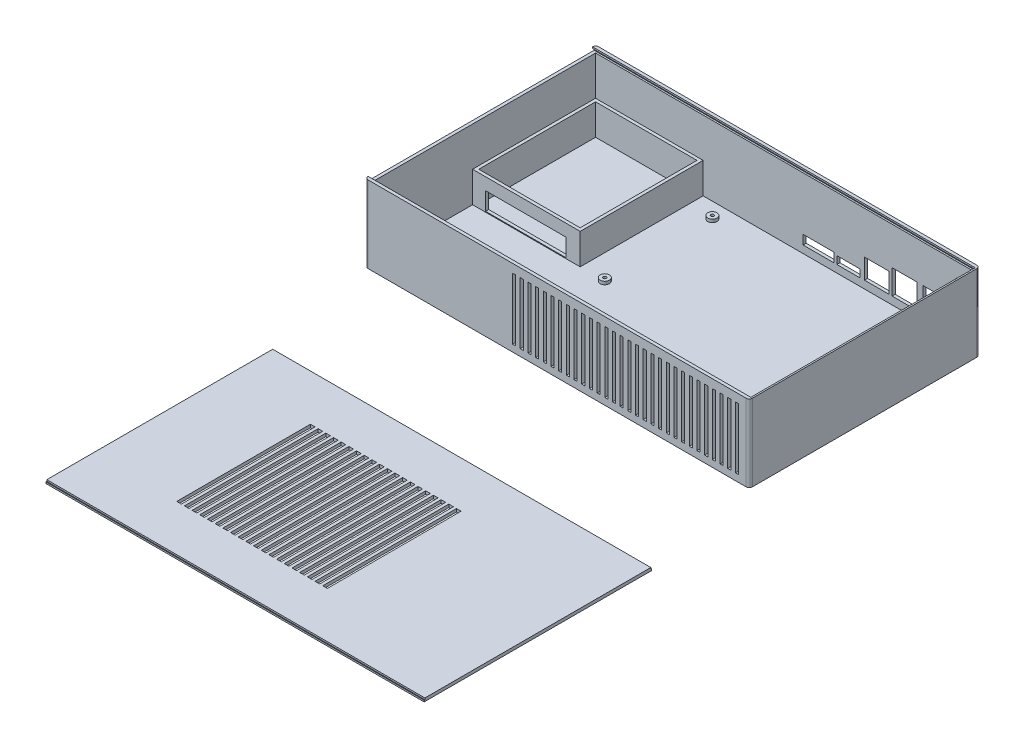
from build123d import *

# Parameters (mm, degrees)
EXTRUDE_1_DEPTH        = 50
SHELL_START            = -233.280796288
SHELL_2_OUTLINE_W      = 48
SHELL_2_OUTLINE_H      = 146
SHELL_2_DEPTH          = 246
SKETCH_2_W             = 10
SKETCH_2_H             = 10
SKETCH_2_W_2           = 16
SKETCH_2_H_2           = 16
SKETCH_2_H_3           = 13
SKETCH_2_W_3           = 15
SKETCH_2_H_4           = 5
SKETCH_2_W_4           = 20
SKETCH_2_H_5           = 6
CUT_EXTRUDE_1_DEPTH    = 50
SKETCH_4_W             = 8
SKETCH_4_H             = 8
CUT_EXTRUDE_2_DEPTH    = 50
SKETCH_5_R             = 3
SKETCH_5_R_2           = 1
EXTRUDE_2_DEPTH        = 2
CUT_EXTRUDE_7_DEPTH    = 249
SKETCH_19_W            = 70
SKETCH_19_H            = 80
SKETCH_19_W_2          = 66
SKETCH_19_H_2          = 76
EXTRUDE_3_DEPTH        = 20
SKETCH_22_W            = 52.413967448
SKETCH_22_H            = 11.586344135
CUT_EXTRUDE_9_DEPTH    = 20
SKETCH_25_W            = 246
SKETCH_25_H            = 148
EXTRUDE_4_DEPTH        = 1
SKETCH_27_W            = 147
SKETCH_27_H            = 1
EXTRUDE_5_DEPTH        = 246
SKETCH_29_W            = 2
SKETCH_29_H            = 40
CUT_EXTRUDE_10_DEPTH   = 59
PATTERN_LINEAR_4_COUNT = 30
PATTERN_LINEAR_4_PITCH = 5
SKETCH_30_W            = 3
SKETCH_30_H            = 87
CUT_EXTRUDE_12_DEPTH   = 59
PATTERN_LINEAR_7_COUNT = 20
PATTERN_LINEAR_7_PITCH = 5


# Read off the part's stored shape, not the designer's step: 抽壳2
with BuildPart() as part:
    # 草图1 → 凸台-拉伸1 (new body)
    with BuildSketch(Plane(origin=(0, 0, 0), x_dir=(1, 0, 0), z_dir=(0, 1, 0))):
        with BuildLine():
            Line((-233.280796288, 5.275604912), (12.719203712, 5.275604912))
            ThreePointArc((12.719203712, 5.275604912), (14.133417274, 4.689818475), (14.719203712, 3.275604912))
            Line((14.719203712, 3.275604912), (14.719203712, -142.724395088))
            ThreePointArc((14.719203712, -142.724395088), (14.133417274, -144.13860865), (12.719203712, -144.724395088))
            Line((12.719203712, -144.724395088), (-233.280796288, -144.724395088))
            ThreePointArc((-233.280796288, -144.724395088), (-234.695009851, -144.13860865), (-235.280796288, -142.724395088))
            Line((-235.280796288, -142.724395088), (-235.280796288, 3.275604912))
            ThreePointArc((-235.280796288, 3.275604912), (-234.695009851, 4.689818475), (-233.280796288, 5.275604912))
        make_face()
    extrude(amount=EXTRUDE_1_DEPTH)

    # 抽壳2 outline → 抽壳2 (cut)
    with BuildSketch(Plane.YZ.offset(SHELL_START)):
        with Locations((26, 69.724395088)):
            Rectangle(SHELL_2_OUTLINE_W, SHELL_2_OUTLINE_H)
    extrude(amount=SHELL_2_DEPTH, mode=Mode.SUBTRACT)

    # 草图2 → 切除-拉伸1 (cut)
    with BuildSketch(Plane(origin=(0, 0, -5.275604912), x_dir=(-1, 0, 0), z_dir=(0, 0, -1))):
        with Locations((-4.719203712, 12)):
            Rectangle(SKETCH_2_W, SKETCH_2_H)
        with Locations((12.280796288, 15)):
            Rectangle(SKETCH_2_W_2, SKETCH_2_H_2)
        with Locations((32.280796288, 15)):
            Rectangle(SKETCH_2_W_2, SKETCH_2_H_2)
        with Locations((50.280796288, 13.5)):
            Rectangle(SKETCH_2_W_2, SKETCH_2_H_3)
        with Locations((68.780796288, 9.32915336)):
            Rectangle(SKETCH_2_W_3, SKETCH_2_H_4)
        with Locations((88.280796288, 9.82915336)):
            Rectangle(SKETCH_2_W_4, SKETCH_2_H_5)
    extrude(amount=-CUT_EXTRUDE_1_DEPTH, mode=Mode.SUBTRACT)

    # 草图4 → 切除-拉伸2 (cut)
    with BuildSketch(Plane(origin=(0, 0, -5.275604912), x_dir=(-1, 0, 0), z_dir=(0, 0, -1))):
        with Locations((-5.268021138, 34.003745446)):
            Rectangle(SKETCH_4_W, SKETCH_4_H)
    extrude(amount=-CUT_EXTRUDE_2_DEPTH, mode=Mode.SUBTRACT)

    # 草图5 → 凸台-拉伸2 (add)
    # profile 1 of 4: a face of its own
    with BuildSketch(Plane(origin=(0, 2, 0), x_dir=(1, 0, 0), z_dir=(0, 1, 0))):
        with Locations(Location((-147.280796288, -6.724395088, 0), (0, 0, 270))):
            Circle(SKETCH_5_R)
        with Locations(Location((-147.280796288, -6.724395088, 0), (0, 0, 270))):
            Circle(SKETCH_5_R_2, mode=Mode.SUBTRACT)
    # profile 2 of 4: a face of its own
    with BuildSketch(Plane(origin=(0, 2, 0), x_dir=(1, 0, 0), z_dir=(0, 1, 0))):
        with Locations(Location((-147.280796288, -76.724395088, 0), (0, 0, 270))):
            Circle(SKETCH_5_R)
        with Locations(Location((-147.280796288, -76.724395088, 0), (0, 0, 270))):
            Circle(SKETCH_5_R_2, mode=Mode.SUBTRACT)
    # profile 3 of 4: a face of its own
    with BuildSketch(Plane(origin=(0, 2, 0), x_dir=(1, 0, 0), z_dir=(0, 1, 0))):
        with Locations(Location((-7.280796288, -31.724395088, 0), (0, 0, 270))):
            Circle(SKETCH_5_R)
        with Locations(Location((-7.280796288, -31.724395088, 0), (0, 0, 270))):
            Circle(SKETCH_5_R_2, mode=Mode.SUBTRACT)
    # profile 4 of 4: a face of its own
    with BuildSketch(Plane(origin=(0, 2, 0), x_dir=(1, 0, 0), z_dir=(0, 1, 0))):
        with Locations(Location((7.719203712, -81.724395088, 0), (0, 0, 270))):
            Circle(SKETCH_5_R)
        with Locations(Location((7.719203712, -81.724395088, 0), (0, 0, 270))):
            Circle(SKETCH_5_R_2, mode=Mode.SUBTRACT)
    extrude(amount=EXTRUDE_2_DEPTH)

    # 草图7 → 切除-拉伸7 (cut)
    with BuildSketch(Plane.ZY.offset(235.280796288)):
        Polygon((-4.329087581, 49), (-4.329087581, 47.5), (143.821498798, 47.5), (143.821498798, 49), (142.724395088, 49), (142.724395088, 50), (-3.275604912, 50), (-3.275604912, 49), align=None)
    extrude(amount=-CUT_EXTRUDE_7_DEPTH, mode=Mode.SUBTRACT)

    # 草图19 → 凸台-拉伸3 (add)
    with BuildSketch(Plane(origin=(0, 2, 0), x_dir=(1, 0, 0), z_dir=(0, 1, 0))):
        with Locations((-198.280796288, -36.724395088)):
            Rectangle(SKETCH_19_W, SKETCH_19_H)
        with Locations((-198.280796288, -36.724395088)):
            Rectangle(SKETCH_19_W_2, SKETCH_19_H_2, mode=Mode.SUBTRACT)
    extrude(amount=EXTRUDE_3_DEPTH)

    # 草图22 → 切除-拉伸9 (cut)
    with BuildSketch(Plane.XY.offset(76.724395088)):
        with Locations((-198.632667177, 8.343227588)):
            Rectangle(SKETCH_22_W, SKETCH_22_H)
    extrude(amount=-CUT_EXTRUDE_9_DEPTH, mode=Mode.SUBTRACT)

    # 草图29 → 切除-拉伸10 (cut)
    with BuildSketch(Plane.XY.offset(144.724395088)):
        with Locations((6.719203712, 24.440262101)):
            Rectangle(SKETCH_29_W, SKETCH_29_H)
    cut_extrude_10 = extrude(amount=-CUT_EXTRUDE_10_DEPTH, mode=Mode.SUBTRACT)

    # 阵列(线性)4: 切除-拉伸10 ×30
    with Locations(*[(-i * PATTERN_LINEAR_4_PITCH, 0, 0) for i in range(1, PATTERN_LINEAR_4_COUNT)]):
        add(cut_extrude_10, mode=Mode.SUBTRACT)


with BuildPart() as body_2:
    # 草图25 → 凸台-拉伸4 (new body)
    with BuildSketch(Plane(origin=(0, 0, 0), x_dir=(1, 0, 0), z_dir=(0, 1, 0))):
        with Locations((-94.901058656, -295.645452779)):
            Rectangle(SKETCH_25_W, SKETCH_25_H)
    extrude(amount=-EXTRUDE_4_DEPTH)

    # 草图27 → 凸台-拉伸5 (add)
    with BuildSketch(Plane.ZY.offset(217.901058656)):
        with Locations((295.645452779, 0.5)):
            Rectangle(SKETCH_27_W, SKETCH_27_H)
    extrude(amount=-EXTRUDE_5_DEPTH)

    # 草图30 → 切除-拉伸12 (cut)
    with BuildSketch(Plane(origin=(0, 1, 0), x_dir=(1, 0, 0), z_dir=(0, 1, 0))):
        with Locations((-161.855117427, -295.645452779)):
            Rectangle(SKETCH_30_W, SKETCH_30_H)
    cut_extrude_12 = extrude(amount=-CUT_EXTRUDE_12_DEPTH, mode=Mode.SUBTRACT)

    # 阵列(线性)7: 切除-拉伸12 ×20
    with Locations(*[(i * PATTERN_LINEAR_7_PITCH, 0, 0) for i in range(1, PATTERN_LINEAR_7_COUNT)]):
        add(cut_extrude_12, mode=Mode.SUBTRACT)


solid = Compound([part.part, body_2.part])
